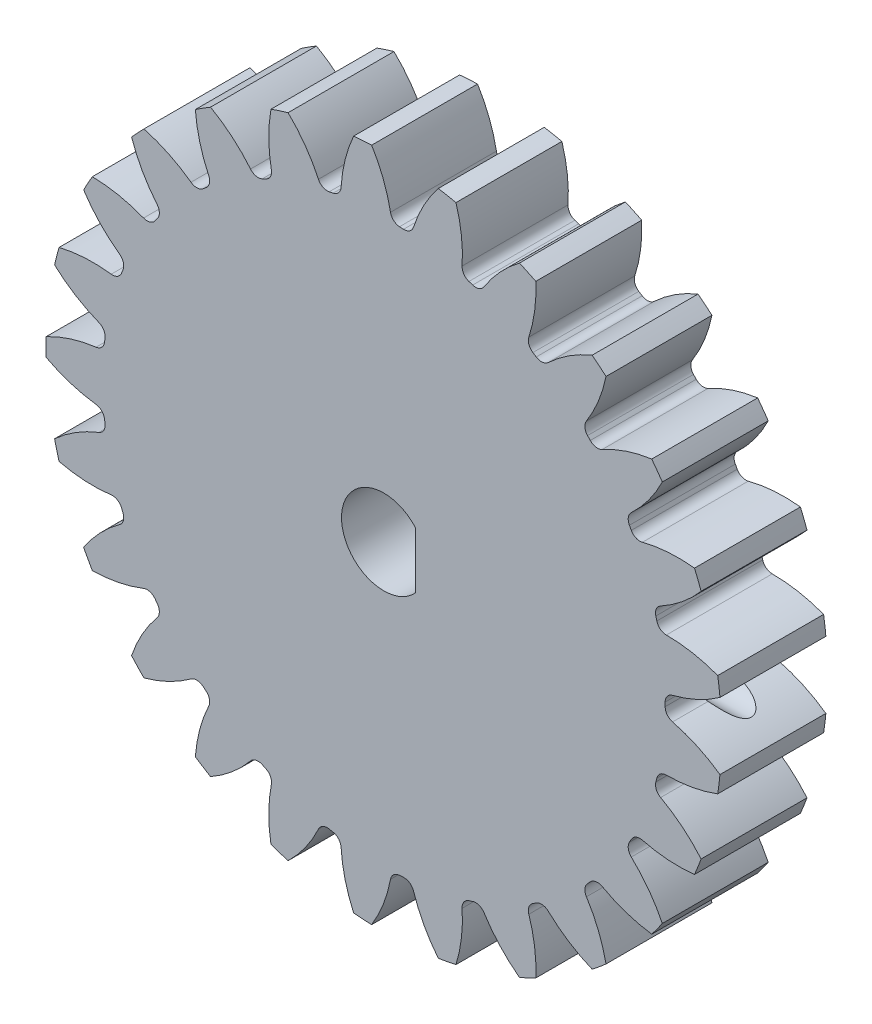
from build123d import *

# Parameters (mm, degrees)
SKETCH3_R                = 20.25
BOSS_EXTRUDE1_DEPTH      = 6.35
CUT_EXTRUDE1_DEPTH       = 30.333385417
FILLET1_R                = 0.589048623
CIRPATTERN1_COUNT        = 25
FILLET1_OF_CIRPATTERN1_R = 0.589048623
CUT_EXTRUDE2_DEPTH       = 30.324242638
SKETCH6_R                = 1.25
CUT_EXTRUDE3_DEPTH       = 31.670714555


with BuildPart() as part:
    # Sketch3 → Boss-Extrude1 (new body)
    with BuildSketch(Plane.XY):
        Circle(SKETCH3_R)
    extrude(amount=-BOSS_EXTRUDE1_DEPTH)

    # Sketch4 → Cut-Extrude1 (cut, symmetric)
    with BuildSketch(Plane.XY):
        with BuildLine():
            Line((16.864716028, 0.589048623), (16.864716028, -0.589048623))
            ThreePointArc((16.864716028, -0.589048623), (18.581658171, -1.123419786), (20.150838436, -2.001551983))
            ThreePointArc((20.150838436, -2.001551983), (20.25, 0), (20.150838436, 2.001551983))
            ThreePointArc((20.150838436, 2.001551983), (18.581658171, 1.123419786), (16.864716028, 0.589048623))
        make_face()
    cut_extrude1 = extrude(amount=CUT_EXTRUDE1_DEPTH, both=True, mode=Mode.SUBTRACT)

    # Fillet1
    fillet1_edges = [part.edges().sort_by_distance(p)[0] for p in [
        (16.864716028, 0.589048623, -3.175),
        (16.864716028, -0.589048623, -3.175),
    ]]
    fillet(fillet1_edges, radius=FILLET1_R)

    # CirPattern1: Cut-Extrude1 ×25 about axis
    cirpattern1_axis = Axis((0, 0, 0), (0, 0, 1))
    for i in range(1, CIRPATTERN1_COUNT):
        add(cut_extrude1.rotate(cirpattern1_axis, i * 360 / CIRPATTERN1_COUNT), mode=Mode.SUBTRACT)

    # Fillet1 of CirPattern1
    fillet1_of_cirpattern1_edges = [part.edges().sort_by_distance(p)[0] for p in [
        (16.188389527, 4.764626903, -3.175),
        (16.481370398, 3.623541749, -3.175),
        (14.494886975, 8.640826152, -3.175),
        (15.062439651, 7.608451667, -3.175),
        (11.890617365, 11.974090515, -3.175),
        (12.697080425, 11.115294584, -3.175),
        (8.539216536, 14.554978734, -3.175),
        (9.533916939, 13.923722663, -3.175),
        (4.651265327, 16.221324109, -3.175),
        (5.771702389, 15.857272039, -3.175),
        (0.471058011, 16.868424033, -3.175),
        (1.646830551, 16.794450695, -3.175),
        (-3.738747612, 16.455618837, -3.175),
        (-2.581517708, 16.676372247, -3.175),
        (-7.713633972, 15.008846589, -3.175),
        (-6.647659714, 15.510456, -3.175),
        (-11.203844341, 12.619013312, -3.175),
        (-10.296104813, 13.369960759, -3.175),
        (-13.990075966, 9.436281019, -3.175),
        (-13.297607779, 10.389381712, -3.175),
        (-15.897259665, 5.660632486, -3.175),
        (-15.463573144, 6.755999602, -3.175),
        (-16.805560074, 1.529305595, -3.175),
        (-16.657905337, 2.698113191, -3.175),
        (-16.657905337, -2.698113191, -3.175),
        (-16.805560074, -1.529305595, -3.175),
        (-15.463573144, -6.755999602, -3.175),
        (-15.897259665, -5.660632486, -3.175),
        (-13.297607779, -10.389381712, -3.175),
        (-13.990075966, -9.436281019, -3.175),
        (-10.296104813, -13.369960759, -3.175),
        (-11.203844341, -12.619013312, -3.175),
        (-6.647659714, -15.510456, -3.175),
        (-7.713633972, -15.008846589, -3.175),
        (-2.581517708, -16.676372247, -3.175),
        (-3.738747612, -16.455618837, -3.175),
        (1.646830551, -16.794450695, -3.175),
        (0.471058011, -16.868424033, -3.175),
        (5.771702389, -15.857272039, -3.175),
        (4.651265327, -16.221324109, -3.175),
        (9.533916939, -13.923722663, -3.175),
        (8.539216536, -14.554978734, -3.175),
        (12.697080425, -11.115294584, -3.175),
        (11.890617365, -11.974090515, -3.175),
        (15.062439651, -7.608451667, -3.175),
        (14.494886975, -8.640826152, -3.175),
        (16.481370398, -3.623541749, -3.175),
        (16.188389527, -4.764626903, -3.175),
    ]]
    fillet(fillet1_of_cirpattern1_edges, radius=FILLET1_OF_CIRPATTERN1_R)

    # Sketch5 → Cut-Extrude2 (cut, through all)
    with BuildSketch(Plane(origin=(0, 0, -6.35), x_dir=(-1, 0, 0), z_dir=(0, 0, -1))):
        with BuildLine():
            Line((-1.905, 1.680052083), (-1.905, -1.680052083))
            ThreePointArc((-1.905, -1.680052083), (2.54, 0), (-1.905, 1.680052083))
        make_face()
    extrude(amount=-CUT_EXTRUDE2_DEPTH, mode=Mode.SUBTRACT)

    # Sketch6 → Cut-Extrude3 (cut, through all)
    with BuildSketch(Plane.ZY.offset(-1.905)):
        with Locations((-3.175, 0)):
            Circle(SKETCH6_R)
    extrude(amount=-CUT_EXTRUDE3_DEPTH, mode=Mode.SUBTRACT)


solid = part.part
